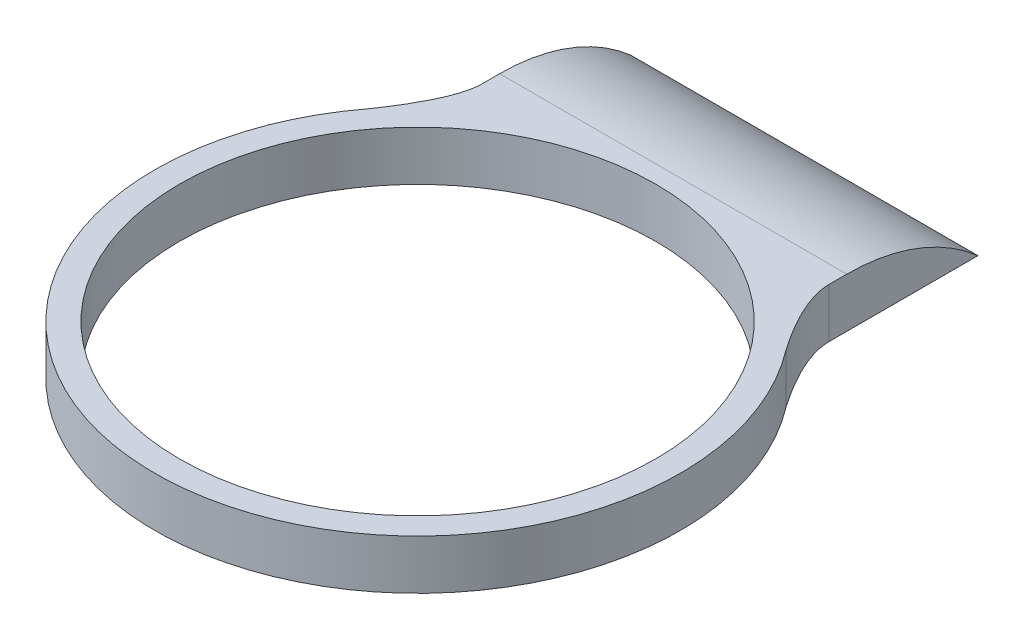
from build123d import *

# Parameters (mm, degrees)
SKETCH1_R           = 48
BOSS_EXTRUDE1_DEPTH = 10
FILLET1_R           = 40


with BuildPart() as part:
    # Sketch1 → Boss-Extrude1 (new body)
    with BuildSketch(Plane(origin=(0, 0, 0), x_dir=(1, 0, 0), z_dir=(0, 1, 0))):
        with BuildLine():
            Line((35, 78), (-35, 78))
            Line((-35, 78), (-35, 48))
            add(Edge.make_bspline(
                [(-35, 48), (-34.99357519, 42.516288621), (-42.093715926, 32.204333242)],
                knots=[0, 0, 0, 1, 1, 1], degree=2))
            ThreePointArc((-42.093715926, 32.204333242), (0, -53), (42.093715926, 32.204333242))
            add(Edge.make_bspline(
                [(35, 48), (34.99357519, 42.516288621), (42.093715926, 32.204333242)],
                knots=[0, 0, 0, 1, 1, 1], degree=2))
            Line((35, 48), (35, 78))
        make_face()
        with Locations(Location((0, 0, 0), (0, 0, 270))):
            Circle(SKETCH1_R, mode=Mode.SUBTRACT)
    extrude(amount=BOSS_EXTRUDE1_DEPTH)

    # Fillet1
    # the kernel refuses this fillet: 40 mm, written as the material it takes off along each edge
    with BuildSketch(Plane(origin=(101.143782777, 10, -78), x_dir=(0, -1, 0), z_dir=(-1, 0, 0))) as fillet1_piece_1:
        with BuildLine():
            CenterArc((40, 26.457513111), FILLET1_R, 180, 41.409622109)
            Line((0, 26.457513111), (-0.8, 26.457513111))
            Line((-0.8, 26.457513111), (-0.8, 0))
            Line((-0.8, 0), (0, -0.8))
            ThreePointArc((0, -0.8), (5, -0.8), (9.4, -0.529150262))
            Line((9.4, -0.529150262), (10, 0))
        make_face()
    extrude(amount=202.287565553, mode=Mode.SUBTRACT)


solid = part.part
